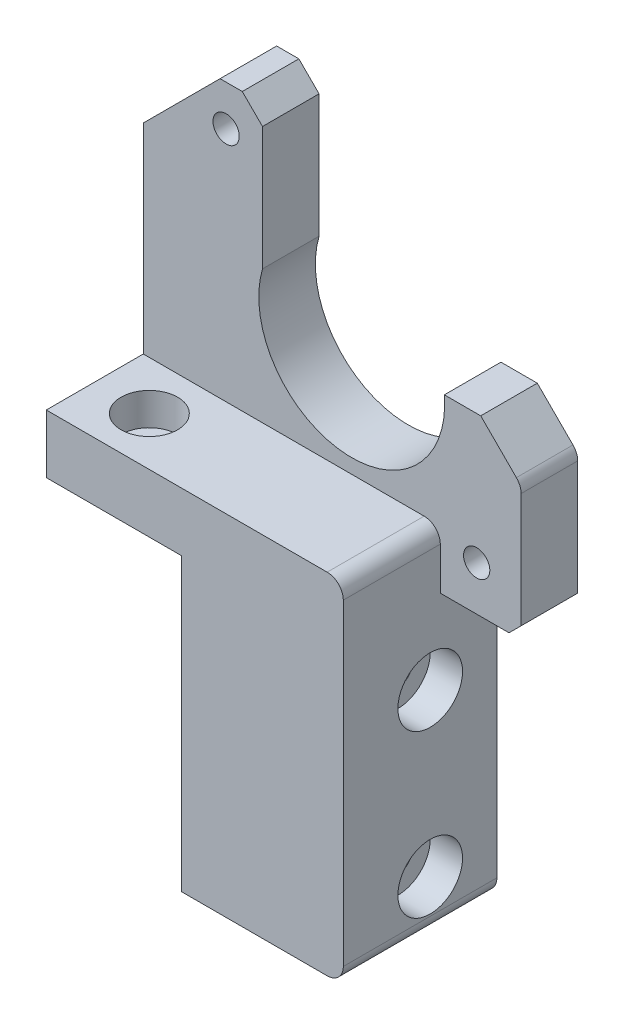
from build123d import *

# Parameters (mm, degrees)
BOSS_EXTRUDE1_DEPTH = 19
BOSS_EXTRUDE2_DEPTH = 7
SKETCH3_R           = 1.75
CUT_EXTRUDE1_DEPTH  = 88.851081382
SKETCH6_R           = 4
CUT_EXTRUDE4_DEPTH  = 4
SKETCH7_R           = 1.625
CUT_EXTRUDE5_DEPTH  = 86.248167136
FILLET1_R           = 2
SKETCH8_R           = 2
CUT_EXTRUDE6_DEPTH  = 56.960365438
SKETCH9_R           = 3.5
CUT_EXTRUDE7_DEPTH  = 4


with BuildPart() as part:
    # Sketch1 → Boss-Extrude1 (new body)
    with BuildSketch(Plane.XY):
        Polygon((0, 0), (20, 0), (20, 43.25), (-16.75, 43.25), (-16.75, 36), (0, 36), align=None)
    extrude(amount=BOSS_EXTRUDE1_DEPTH)

    # Sketch2 → Boss-Extrude2 (add)
    with BuildSketch(Plane(origin=(0, 0, 0), x_dir=(-1, 0, 0), z_dir=(0, 0, -1))):
        with BuildLine():
            Line((-20, 36), (16.75, 36))
            Line((16.75, 36), (16.75, 68))
            Line((16.75, 68), (7.25, 77.5))
            Line((7.25, 77.5), (4.5, 77.5))
            Line((4.5, 77.5), (2, 75))
            Line((2, 75), (2, 59.75))
            ThreePointArc((2, 59.75), (-7.896468276, 45.089682755), (-20.5, 57.5))
            Line((-20.5, 57.5), (-25, 57.5))
            Line((-25, 57.5), (-30, 52.5))
            Line((-30, 52.5), (-30, 37.5))
            Line((-30, 37.5), (-28.5, 36))
            Line((-28.5, 36), (-20, 36))
        make_face()
    extrude(amount=-BOSS_EXTRUDE2_DEPTH)

    # Sketch3 → Cut-Extrude1 (cut, through all)
    with BuildSketch(Plane(origin=(20, 0, 0), x_dir=(0, 0, -1), z_dir=(1, 0, 0))):
        with Locations((-8.25, 26.25)):
            Circle(SKETCH3_R)
        with Locations((-8.25, 6.25)):
            Circle(SKETCH3_R)
    extrude(amount=-CUT_EXTRUDE1_DEPTH, mode=Mode.SUBTRACT)

    # Sketch6 → Cut-Extrude4 (cut)
    with BuildSketch(Plane(origin=(20, 0, 0), x_dir=(0, 0, -1), z_dir=(1, 0, 0))):
        with Locations((-8.25, 26.25)):
            Circle(SKETCH6_R)
        with Locations((-8.25, 6.25)):
            Circle(SKETCH6_R)
    extrude(amount=-CUT_EXTRUDE4_DEPTH, mode=Mode.SUBTRACT)

    # Sketch7 → Cut-Extrude5 (cut, through all)
    with BuildSketch(Plane(origin=(0, 0, 0), x_dir=(-1, 0, 0), z_dir=(0, 0, -1))):
        with Locations((6.5, 72.5)):
            Circle(SKETCH7_R)
        with Locations((-24.5, 41.5)):
            Circle(SKETCH7_R)
    extrude(amount=-CUT_EXTRUDE5_DEPTH, mode=Mode.SUBTRACT)

    # Fillet1
    fillet1_edges = [part.edges().sort_by_distance(p)[0] for p in [
        (20, 43.25, 13),
        (30, 52.5, 3.5),
        (20, 0, 9.5),
    ]]
    fillet(fillet1_edges, radius=FILLET1_R)

    # Sketch8 → Cut-Extrude6 (cut, through all)
    with BuildSketch(Plane(origin=(0, 43.25, 0), x_dir=(1, 0, 0), z_dir=(0, 1, 0))):
        with Locations((-10, -13)):
            Circle(SKETCH8_R)
    extrude(amount=-CUT_EXTRUDE6_DEPTH, mode=Mode.SUBTRACT)

    # Sketch9 → Cut-Extrude7 (cut)
    with BuildSketch(Plane(origin=(0, 43.25, 0), x_dir=(1, 0, 0), z_dir=(0, 1, 0))):
        with Locations((-10, -13)):
            Circle(SKETCH9_R)
    extrude(amount=-CUT_EXTRUDE7_DEPTH, mode=Mode.SUBTRACT)


solid = part.part
